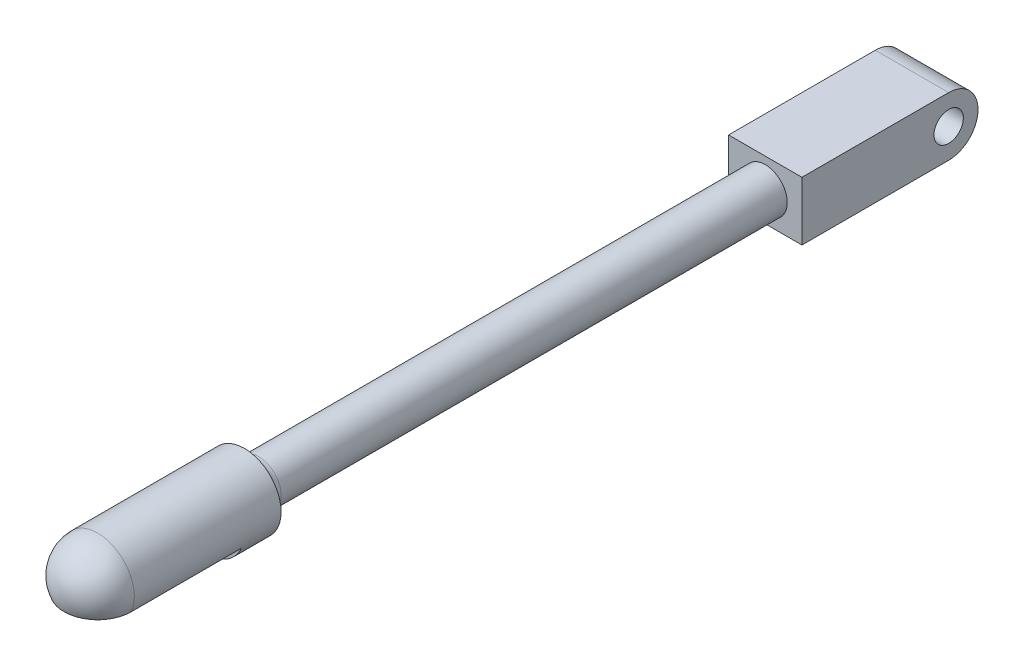
from build123d import *
from build123d.topology import SkipClean

# Parameters (mm, degrees)
SKETCH_1_R          = 1.5
EXTRUDE_1_DEPTH     = 17.705
SKETCH_2_R          = 2.5
EXTRUDE_2_DEPTH     = 10
FILLET_1_R          = 1
CUT_EXTRUDE_1_DEPTH = 10
EXTRUDE_START       = 17.795
SKETCH_6_R          = 1.5
EXTRUDE_3_DEPTH     = 17.795
SKETCH_7_R          = 1
EXTRUDE_4_DEPTH     = 2.5


with BuildPart() as part:
    # 草图1 → 凸台-拉伸1 (new body)
    with BuildSketch(Plane.XY):
        Circle(SKETCH_1_R)
    extrude(amount=EXTRUDE_1_DEPTH)

    # 草图2 → 凸台-拉伸2 (add)
    with BuildSketch(Plane.XY.offset(17.705)):
        Circle(SKETCH_2_R)
    extrude(amount=EXTRUDE_2_DEPTH)

    # 圆角1
    fillet_1_edges = [part.edges().sort_by_distance(p)[0] for p in [
        (-1.5, 0, 17.705),
    ]]
    fillet(fillet_1_edges, radius=FILLET_1_R - 0.0001)  # a hair under: the kernel refuses the full size

    # 草图3 → 旋转1 (revolve)
    with SkipClean():  # the faces are left unmerged after this step: merging them gives an invalid solid
        with BuildSketch(Plane(origin=(0, 0, 0), x_dir=(0, 0, -1), z_dir=(1, 0, 0))):
            with BuildLine():
                ThreePointArc((-30.205, 0), (-27.705, -2.5), (-25.205, 0))
                Line((-25.205, 0), (-27.705, 0))
                Line((-27.705, 0), (-30.205, 0))
            make_face()
            with BuildLine():
                Line((-27.705, 0), (-25.205, 0))
                ThreePointArc((-25.205, 0), (-27.705, 2.5), (-30.205, 0))
                Line((-30.205, 0), (-27.705, 0))
            make_face()
        revolve(axis=Axis((0, 0, 0), (0, 0, 1)))
    add(part.part.scale(1), mode=Mode.REPLACE)  # the faces are merged on a copy

    # 草图4 → 切除-拉伸1 (cut)
    with BuildSketch(Plane.XY.offset(30.205)):
        Polygon((-2.5, -1), (0, -1), (2.5, -1), (2.5, -3), (-2.5, -3), align=None)
    extrude(amount=-CUT_EXTRUDE_1_DEPTH, mode=Mode.SUBTRACT)

    # 草图5 → 切除-旋转11 (revolve, cut)
    with BuildSketch(Plane(origin=(0, 0, 0), x_dir=(0, 0, -1), z_dir=(1, 0, 0))):
        with BuildLine():
            Line((-26.25, 0), (-29.16, 0))
            ThreePointArc((-29.16, 0), (-27.705, -1.455), (-26.25, 0))
        make_face()
    revolve(axis=Axis((0, 0, 0), (0, 0, 1)), mode=Mode.SUBTRACT)

    # 草图6 → 凸台-拉伸3 (add)
    with SkipClean():  # the faces are left unmerged after this step: merging them gives an invalid solid
        with BuildSketch(Plane(origin=(0, 0, 0), x_dir=(-1, 0, 0), z_dir=(0, 0, -1)).offset(EXTRUDE_START)):
            Circle(SKETCH_6_R)
        extrude(amount=-EXTRUDE_3_DEPTH)

    # 草图7 → 凸台-拉伸4 (add, symmetric)
    with BuildSketch(Plane(origin=(0, 0, 0), x_dir=(0, 0, -1), z_dir=(1, 0, 0))):
        with BuildLine():
            Line((17.795, -2), (27.795, -2))
            ThreePointArc((27.795, -2), (29.795, 0), (27.795, 2))
            Line((27.795, 2), (17.795, 2))
            Line((17.795, 2), (17.795, -2))
        make_face()
        with Locations((27.795, 0)):
            Circle(SKETCH_7_R, mode=Mode.SUBTRACT)
    extrude(amount=EXTRUDE_4_DEPTH, both=True)


solid = part.part
